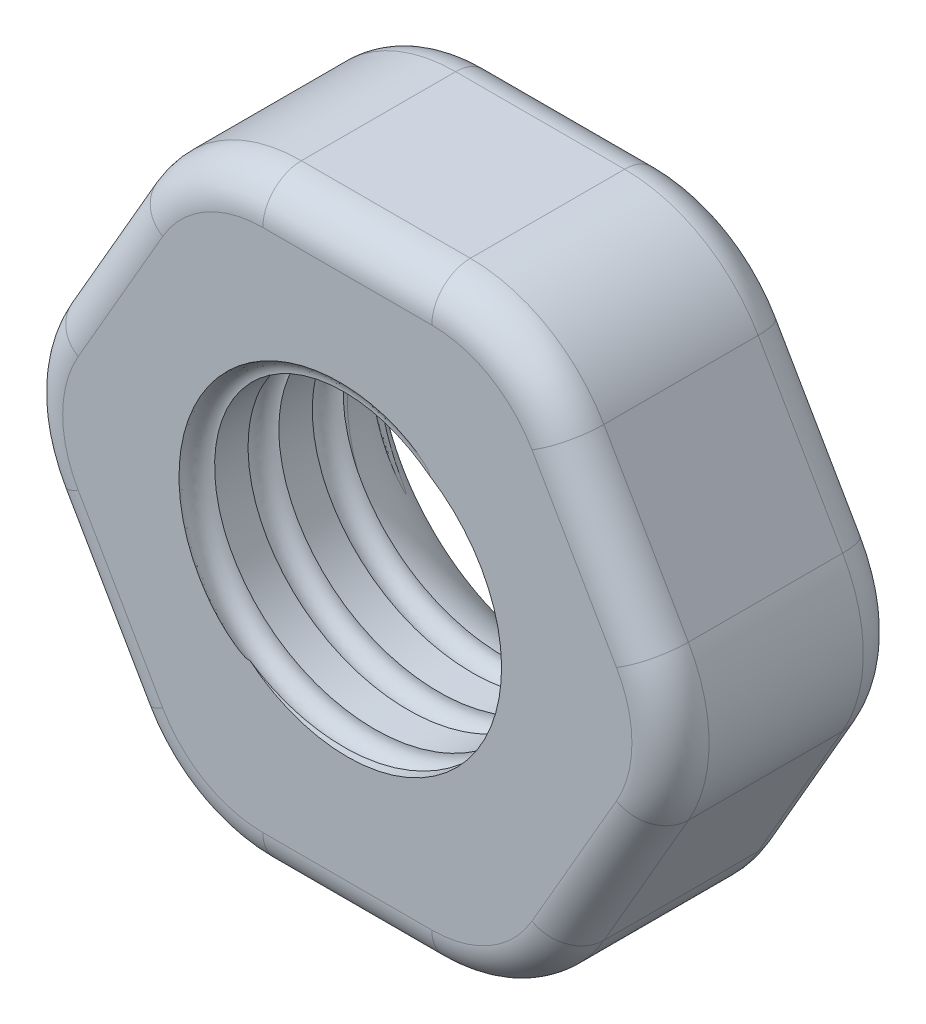
from build123d import *

# Parameters (mm, degrees)
SKETCH1_R           = 2
BOSS_EXTRUDE1_DEPTH = 3
CUT_SWEEP8_PITCH    = 0.8333333
FILLET1_R           = 0.5
FILLET6_R           = 0.5


with BuildPart() as part:
    # Sketch1 → Boss-Extrude1 (new body)
    with BuildSketch(Plane.XY):
        with BuildLine():
            Line((3.922649731, 1), (2.827350269, 2.897114317))
            ThreePointArc((2.827350269, 2.897114317), (2.095299462, 3.629165125), (1.095299462, 3.897114317))
            Line((1.095299462, 3.897114317), (-1.095299462, 3.897114317))
            ThreePointArc((-1.095299462, 3.897114317), (-2.095299462, 3.629165125), (-2.827350269, 2.897114317))
            Line((-2.827350269, 2.897114317), (-3.922649731, 1))
            ThreePointArc((-3.922649731, 1), (-4.190598923, 0), (-3.922649731, -1))
            Line((-3.922649731, -1), (-2.827350269, -2.897114317))
            ThreePointArc((-2.827350269, -2.897114317), (-2.095299462, -3.629165125), (-1.095299462, -3.897114317))
            Line((-1.095299462, -3.897114317), (1.095299462, -3.897114317))
            ThreePointArc((1.095299462, -3.897114317), (2.095299462, -3.629165125), (2.827350269, -2.897114317))
            Line((2.827350269, -2.897114317), (3.922649731, -1))
            ThreePointArc((3.922649731, -1), (4.190598923, 0), (3.922649731, 1))
        make_face()
        Circle(SKETCH1_R, mode=Mode.SUBTRACT)
    extrude(amount=BOSS_EXTRUDE1_DEPTH)

    # Cut-Sweep8: arcs per turn and ends read off the stored shape
    # Cut-Sweep8: the profile of Sketch4 screwed along a left-hand helix through 4.75 turns, 8 arcs to a turn; built about Z, then put on its axis
    cut_sweep8_z = Axis((0, 0, 0), (0, 0, 1))
    cut_sweep8_corners = [(2, 0, -0.199999996), (1.8, 0, 4e-09), (2, 0, 0.200000004), (2.2, 0, 4e-09)]
    with BuildLine(mode=Mode.PRIVATE) as cut_sweep8_profile:
        ThreePointArc((2, 0, -0.199999996), (1.858578644, 0, -0.141421352), (1.8, 0, 4e-09))
        ThreePointArc((1.8, 0, 4e-09), (1.858578644, 0, 0.14142136), (2, 0, 0.200000004))
        ThreePointArc((2, 0, 0.200000004), (2.141421356, 0, 0.14142136), (2.2, 0, 4e-09))
        ThreePointArc((2.2, 0, 4e-09), (2.141421356, 0, -0.141421352), (2, 0, -0.199999996))
    cut_sweep8_cap = Face(cut_sweep8_profile.wire())
    cut_sweep8_arcs = [((2, 0, -0.199999996), (1.8, 0, -0.199999996), (1.8, 0, 4e-09), (1, 0.7071067811865476, 1)), ((1.8, 0, 4e-09), (1.8, 0, 0.200000004), (2, 0, 0.200000004), (1, 0.7071067811865476, 1)), ((2, 0, 0.200000004), (2.2, 0, 0.200000004), (2.2, 0, 4e-09), (1, 0.7071067811865476, 1)), ((2.2, 0, 4e-09), (2.2, 0, -0.199999996), (2, 0, -0.199999996), (1, 0.7071067811865476, 1))]  # start, shoulder, end, weights
    cut_sweep8_turn_angles = [0, -22.5, -45, -67.5, -90, -112.5, -135, -157.5, -180, -202.5, -225, -247.5, -270, -292.5, -315, -337.5, -360]
    cut_sweep8_turn_weights = [1, 0.9238795325112867, 1, 0.9238795325112867, 1, 0.9238795325112867, 1, 0.9238795325112867, 1, 0.9238795325112867, 1, 0.9238795325112867, 1, 0.9238795325112867, 1, 0.9238795325112867, 1]
    cut_sweep8_turn_sides = [Face.make_bezier_surface([[Vector(p[j][0], p[j][1], 0).rotate(cut_sweep8_z, cut_sweep8_turn_angles[2 * i + k]) / cut_sweep8_turn_weights[2 * i + k] + Vector(0, 0, p[j][2] + -CUT_SWEEP8_PITCH * cut_sweep8_turn_angles[2 * i + k] / 360) for k in range(3)] for j in range(3)], [[p[3][j] * cut_sweep8_turn_weights[2 * i + k] for k in range(3)] for j in range(3)]) for p in cut_sweep8_arcs for i in range(8)]
    cut_sweep8_last_angles = [-1440, -1462.5, -1485, -1507.5, -1530, -1552.5, -1575, -1597.5, -1620, -1642.5, -1665, -1687.5, -1710]
    cut_sweep8_last_weights = [1, 0.9238795325112867, 1, 0.9238795325112867, 1, 0.9238795325112867, 1, 0.9238795325112867, 1, 0.9238795325112867, 1, 0.9238795325112776, 1]
    cut_sweep8_last_sides = [Face.make_bezier_surface([[Vector(p[j][0], p[j][1], 0).rotate(cut_sweep8_z, cut_sweep8_last_angles[2 * i + k]) / cut_sweep8_last_weights[2 * i + k] + Vector(0, 0, p[j][2] + -CUT_SWEEP8_PITCH * cut_sweep8_last_angles[2 * i + k] / 360) for k in range(3)] for j in range(3)], [[p[3][j] * cut_sweep8_last_weights[2 * i + k] for k in range(3)] for j in range(3)]) for p in cut_sweep8_arcs for i in range(6)]
    cut_sweep8 = Plane(origin=(0, 0, 0), x_dir=(1, 0, 0), z_dir=(0, 0, 1)) * Solid(Shell([*[p.moved(Location((0, 0, CUT_SWEEP8_PITCH * i))) for i in range(4) for p in cut_sweep8_turn_sides], *cut_sweep8_last_sides, cut_sweep8_cap, cut_sweep8_cap.rotate(cut_sweep8_z, -1710).moved(Location((0, 0, -CUT_SWEEP8_PITCH * -1710 / 360)))]))
    add(cut_sweep8, mode=Mode.SUBTRACT)

    # Fillet1
    fillet1_edges = [part.edges().sort_by_distance(p)[0] for p in [
        (4.190598923, 0, 0),
        (3.375, -1.948557159, 0),
        (2.095299462, -3.629165125, 0),
        (0, -3.897114317, 0),
        (-2.095299462, -3.629165125, 0),
        (-3.375, -1.948557159, 0),
        (-4.190598923, 0, 0),
        (-3.375, 1.948557159, 0),
        (-2.095299462, 3.629165125, 0),
        (0, 3.897114317, 0),
        (2.095299462, 3.629165125, 0),
        (3.375, 1.948557159, 0),
    ]]
    fillet(fillet1_edges, radius=FILLET1_R)

    # Fillet6
    fillet6_edges = [part.edges().sort_by_distance(p)[0] for p in [
        (3.375, 1.948557159, 3),
        (2.095299462, 3.629165125, 3),
        (0, 3.897114317, 3),
        (-2.095299462, 3.629165125, 3),
        (-3.375, 1.948557159, 3),
        (-4.190598923, 0, 3),
        (-3.375, -1.948557159, 3),
        (-2.095299462, -3.629165125, 3),
        (0, -3.897114317, 3),
        (2.095299462, -3.629165125, 3),
        (3.375, -1.948557159, 3),
        (4.190598923, 0, 3),
    ]]
    fillet(fillet6_edges, radius=FILLET6_R)

    # Fillet7: read off the stored shape, not the designer's step
    # Fillet7 outline → Fillet7 (revolve, cut)
    with BuildSketch(Plane.XZ):
        with BuildLine():
            ThreePointArc((3, 0), (2.292893217, 0.29289322), (2, 1.000000005))
            Line((2, 1.000000005), (2, 0))
            Line((2, 0), (3, 0))
        make_face()
    revolve(axis=Axis((0, 0, 0), (0, 0, 1)), mode=Mode.SUBTRACT)


solid = part.part
